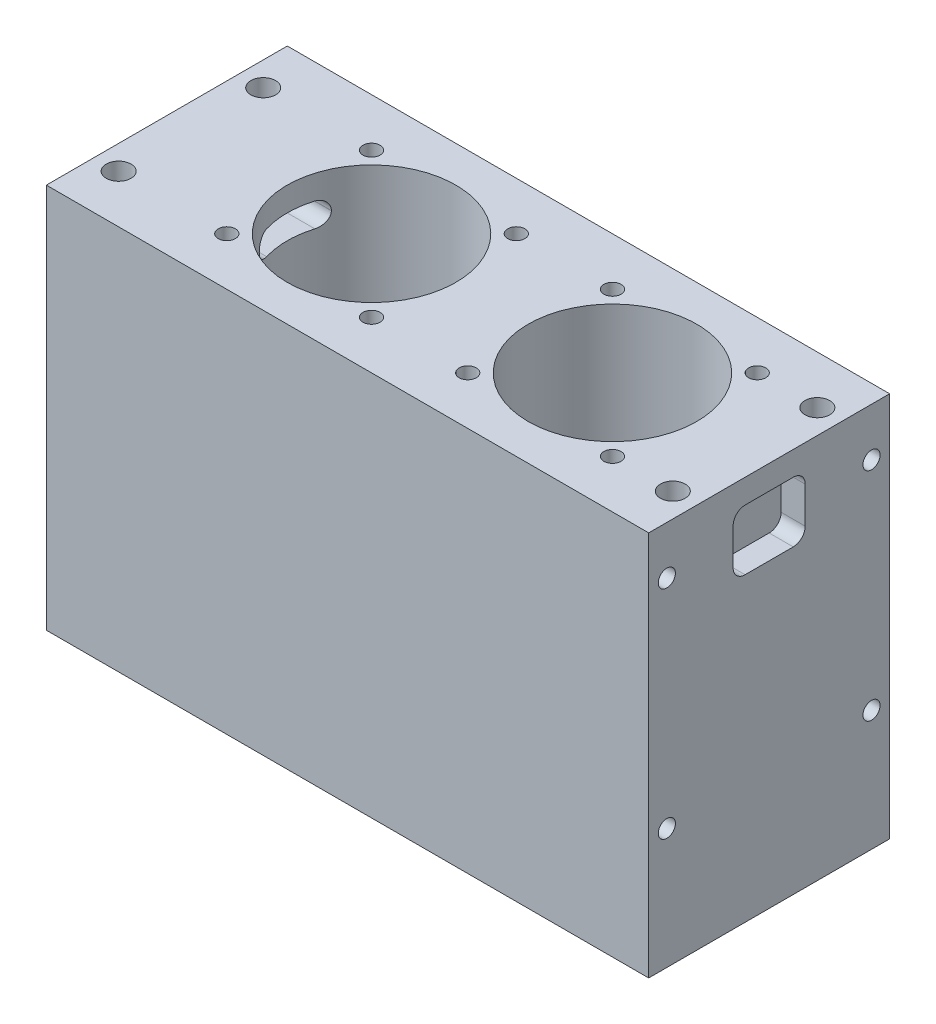
from build123d import *

# Parameters (mm, degrees)
SKETCH1_W                      = 39.6875
SKETCH1_H                      = 15.875
BOSS_EXTRUDE1_DEPTH            = 50.8
F_30_0_1285_DIAMETER_HOLE1_D   = 3.2639
F_4_40_TAPPED_HOLE1_D          = 2.2606
F_4_40_TAPPED_HOLE1_DEPTH      = 9.652
F_4_40_TAPPED_HOLE1_TIP        = 0.679152758
SKETCH7_R                      = 11.1125
CUT_EXTRUDE1_DEPTH             = 67.390912641
F_4_40_TAPPED_HOLE2_AT_2_COUNT = 2
F_4_40_TAPPED_HOLE2_AT_2_PITCH = 19.074064001
F_4_40_TAPPED_HOLE2_AT_3_COUNT = 2
F_4_40_TAPPED_HOLE2_AT_3_PITCH = 26.9748
F_4_40_TAPPED_HOLE2_AT_4_COUNT = 2
F_4_40_TAPPED_HOLE2_AT_4_PITCH = 19.074064001
LPATTERN1_COUNT                = 2
LPATTERN1_PITCH                = 31.75
CUT_EXTRUDE2_REACH             = 97.567
CUT_EXTRUDE2_END_RADIUS        = 11.1125
SKETCH10_W                     = 9.4996
SKETCH10_H                     = 3.175
FILLET1_R                      = 1.5748
SKETCH11_W                     = 9.4996
SKETCH11_H                     = 6.3754
CUT_EXTRUDE3_DEPTH             = 3.175
FILLET2_R                      = 1.5748
MIRROR3_START                  = -39.6875
MIRROR3_DEPTH                  = 16.928554124
MIRROR3_2_DEPTH                = 3.175


# Read off the part's stored shape, not the designer's step: Mirror3
with BuildPart() as part:
    # Sketch1 → Boss-Extrude1 (new body)
    with BuildSketch(Plane(origin=(0, 0, 0), x_dir=(1, 0, 0), z_dir=(0, 1, 0))):
        with Locations((19.84375, 7.9375)):
            Rectangle(SKETCH1_W, SKETCH1_H)
    extrude(amount=-BOSS_EXTRUDE1_DEPTH)

    # #30 (0.1285) Diameter Hole1 (through all)
    with Locations(Plane(origin=(0, 0, 0), x_dir=(-1, 0, 0), z_dir=(0, 1, 0))):
        with Locations((-36.5125, -9.525)):
            Hole(F_30_0_1285_DIAMETER_HOLE1_D / 2)

    # #4-40 Tapped Hole1
    with Locations(Plane(origin=(39.6875, 0, 0), x_dir=(0, 0, -1), z_dir=(1, 0, 0))):
        with Locations((13.4874, -6.35), (13.4874, -34.925)):
            Hole(F_4_40_TAPPED_HOLE1_D / 2, depth=F_4_40_TAPPED_HOLE1_DEPTH)
            with Locations((0, 0, -(F_4_40_TAPPED_HOLE1_DEPTH + F_4_40_TAPPED_HOLE1_TIP / 2))):  # 118° drill point
                Cone(0, F_4_40_TAPPED_HOLE1_D / 2, F_4_40_TAPPED_HOLE1_TIP, mode=Mode.SUBTRACT)

    # Mirror1: part across plane


with BuildPart() as part_1:
    add(part.part)
    add(part.part.mirror(Plane(origin=(0, -50.8, 0), x_dir=(1, 0, 0), z_dir=(0, 0, 1))))

    # Mirror2: part across plane


with BuildPart() as part_2:
    add(part_1.part)
    add(part_1.part.mirror(Plane(origin=(0, -50.8, -15.875), x_dir=(0, 0, 1), z_dir=(-1, 0, 0))))

    # Sketch7 → Cut-Extrude1 (cut, through all)
    with BuildSketch(Plane(origin=(0, 0, 0), x_dir=(-1, 0, 0), z_dir=(0, 1, 0))):
        with Locations(Location((-19.0373, 0, 0), (0, 0, 90))):
            Circle(SKETCH7_R)
    cut_extrude1 = extrude(amount=-CUT_EXTRUDE1_DEPTH, mode=Mode.SUBTRACT)

    # Sketch8 → #4-40 Tapped Hole2 (revolve, cut)
    with BuildSketch(Plane(origin=(9.500267999, 0, -9.537032001), x_dir=(0, 0, 1), z_dir=(1, 0, 0))):
        Polygon((0, 0), (0, 10.331152758), (1.1303, 9.652), (1.1303, 0), align=None)
    f_4_40_tapped_hole2 = revolve(axis=Axis((9.500267999, 6.35, -9.537032001), (0, -1, 0)), mode=Mode.SUBTRACT)

    # #4-40 Tapped Hole2 at 2: #4-40 Tapped Hole2 ×2
    with Locations(*[(i * F_4_40_TAPPED_HOLE2_AT_2_PITCH, 0, 0) for i in range(1, F_4_40_TAPPED_HOLE2_AT_2_COUNT)]):
        add(f_4_40_tapped_hole2, mode=Mode.SUBTRACT)

    # #4-40 Tapped Hole2 at 3: #4-40 Tapped Hole2 ×2
    with Locations(*[Vector(0.7071067811865515, 0, 0.7071067811865436) * (i * F_4_40_TAPPED_HOLE2_AT_3_PITCH) for i in range(1, F_4_40_TAPPED_HOLE2_AT_3_COUNT)]):
        add(f_4_40_tapped_hole2, mode=Mode.SUBTRACT)

    # #4-40 Tapped Hole2 at 4: #4-40 Tapped Hole2 ×2
    with Locations(*[(0, 0, i * F_4_40_TAPPED_HOLE2_AT_4_PITCH) for i in range(1, F_4_40_TAPPED_HOLE2_AT_4_COUNT)]):
        add(f_4_40_tapped_hole2, mode=Mode.SUBTRACT)

    # LPattern1: Cut-Extrude1, #4-40 Tapped Hole2 ×2
    with Locations(*[(-i * LPATTERN1_PITCH, 0, 0) for i in range(1, LPATTERN1_COUNT)]):
        add(cut_extrude1, mode=Mode.SUBTRACT)
        add(f_4_40_tapped_hole2, mode=Mode.SUBTRACT)

    # LPattern1 copy 1 sketch → LPattern1 copy 1 (revolve, cut)
    with BuildSketch(Plane(origin=(-3.175667999, 0, -9.537032001), x_dir=(0, 0, 1), z_dir=(1, 0, 0))):
        Polygon((0, 0), (0, 10.331152758), (1.1303, 9.652), (1.1303, 0), align=None)
    revolve(axis=Axis((-3.175667999, 6.35, -9.537032001), (0, -1, 0)), mode=Mode.SUBTRACT)

    # LPattern1 copy 2 sketch → LPattern1 copy 2 (revolve, cut)
    with BuildSketch(Plane(origin=(-3.175667999, 0, 9.537032001), x_dir=(0, 0, 1), z_dir=(1, 0, 0))):
        Polygon((0, 0), (0, 10.331152758), (1.1303, 9.652), (1.1303, 0), align=None)
    revolve(axis=Axis((-3.175667999, 6.35, 9.537032001), (0, -1, 0)), mode=Mode.SUBTRACT)

    # LPattern1 copy 3 sketch → LPattern1 copy 3 (revolve, cut)
    with BuildSketch(Plane(origin=(-22.249732001, 0, 9.537032001), x_dir=(0, 0, 1), z_dir=(1, 0, 0))):
        Polygon((0, 0), (0, 10.331152758), (1.1303, 9.652), (1.1303, 0), align=None)
    revolve(axis=Axis((-22.249732001, 6.35, 9.537032001), (0, -1, 0)), mode=Mode.SUBTRACT)

    # Cut-Extrude2: up to this cylinder (the profile starts outside it)
    cut_extrude2_end = Plane(origin=(19.0373, -4.7625, 0), z_dir=(0, 1, 0)) * Cylinder(CUT_EXTRUDE2_END_RADIUS, 218.359, mode=Mode.PRIVATE)
    # Sketch10 → Cut-Extrude2 (cut, up to the surface)
    with BuildSketch(Plane(origin=(39.6875, 0, 0), x_dir=(0, 0, -1), z_dir=(1, 0, 0)), mode=Mode.PRIVATE) as cut_extrude2_sk1:
        with Locations((0, -4.7625)):
            Rectangle(SKETCH10_W, SKETCH10_H)
    cut_extrude2_tool1 = extrude(cut_extrude2_sk1.sketch, amount=-CUT_EXTRUDE2_REACH, mode=Mode.PRIVATE) - cut_extrude2_end
    add(cut_extrude2_tool1.solids().sort_by_distance((39.6875, -4.7625, 0))[0], mode=Mode.SUBTRACT)

    # Fillet1
    fillet1_edges = [part_2.edges().sort_by_distance(p)[0] for p in [
        (34.385522938, -6.35, 4.7498),
        (34.385522938, -3.175, 4.7498),
        (34.385522938, -3.175, -4.7498),
        (34.385522938, -6.35, -4.7498),
    ]]
    fillet(fillet1_edges, radius=FILLET1_R)

    # Sketch11 → Cut-Extrude3 (cut)
    with BuildSketch(Plane(origin=(39.6875, 0, 0), x_dir=(0, 0, -1), z_dir=(1, 0, 0))):
        with Locations((0, -7.9375)):
            Rectangle(SKETCH11_W, SKETCH11_H)
    extrude(amount=-CUT_EXTRUDE3_DEPTH, mode=Mode.SUBTRACT)

    # Fillet2
    fillet2_edges = [part_2.edges().sort_by_distance(p)[0] for p in [
        (38.1, -11.1252, -4.7498),
        (38.1, -11.1252, 4.7498),
    ]]
    fillet(fillet2_edges, radius=FILLET2_R)

    # Mirror3 outline → Mirror3 (cut)
    with BuildSketch(Plane.YZ.offset(MIRROR3_START)):
        with BuildLine():
            Line((-6.35, 3.175), (-6.35, -3.175))
            ThreePointArc((-6.35, -3.175), (-5.888751759, -4.288551759), (-4.7752, -4.7498))
            Line((-4.7752, -4.7498), (-4.7498, -4.7498))
            ThreePointArc((-4.7498, -4.7498), (-3.636248241, -4.288551759), (-3.175, -3.175))
            Line((-3.175, -3.175), (-3.175, 3.175))
            ThreePointArc((-3.175, 3.175), (-3.636248241, 4.288551759), (-4.7498, 4.7498))
            Line((-4.7498, 4.7498), (-4.7752, 4.7498))
            ThreePointArc((-4.7752, 4.7498), (-5.888751759, 4.288551759), (-6.35, 3.175))
        make_face()
    extrude(amount=MIRROR3_DEPTH, mode=Mode.SUBTRACT)

    # Mirror3 2 outline → Mirror3 2 (cut)
    with BuildSketch(Plane.YZ.offset(MIRROR3_START)):
        with BuildLine():
            ThreePointArc((-4.7752, -4.7498), (-5.888751759, -4.288551759), (-6.35, -3.175))
            Line((-6.35, -3.175), (-6.35, 3.175))
            ThreePointArc((-6.35, 3.175), (-5.888751759, 4.288551759), (-4.7752, 4.7498))
            Line((-4.7752, 4.7498), (-9.5504, 4.7498))
            ThreePointArc((-9.5504, 4.7498), (-10.663951759, 4.288551759), (-11.1252, 3.175))
            Line((-11.1252, 3.175), (-11.1252, -3.175))
            ThreePointArc((-11.1252, -3.175), (-10.663951759, -4.288551759), (-9.5504, -4.7498))
            Line((-9.5504, -4.7498), (-4.7752, -4.7498))
        make_face()
    extrude(amount=MIRROR3_2_DEPTH, mode=Mode.SUBTRACT)


solid = part_2.part
